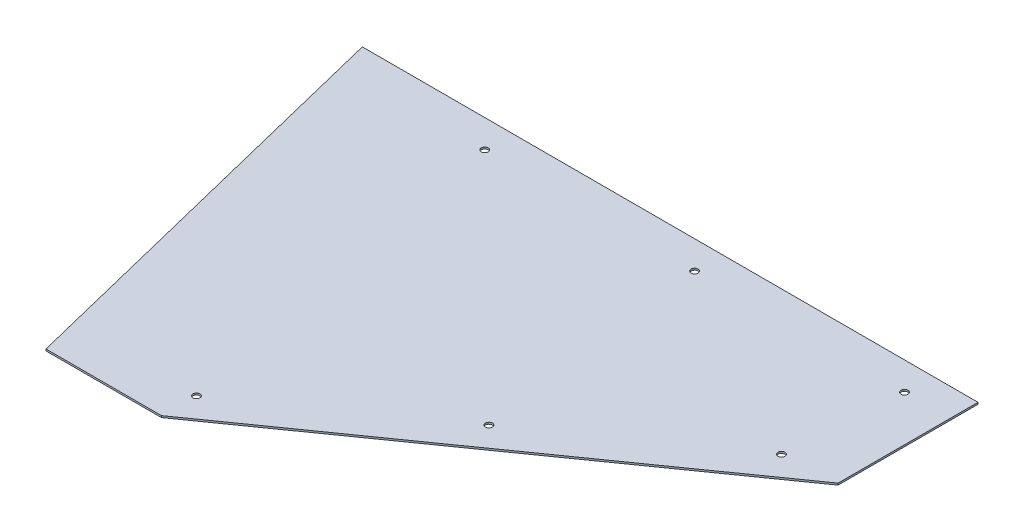
from build123d import *

# Parameters (mm, degrees)
BOSS_EXTRUDE1_DEPTH = 3.175
CUT_EXTRUDE1_REACH  = 1204.171
SKETCH2_R           = 6.35


with BuildPart() as part:
    # Sketch1 → Boss-Extrude1 (new body)
    with BuildSketch(Plane(origin=(0, 0, 0), x_dir=(1, 0, 0), z_dir=(0, 1, 0))):
        Polygon((0, 0), (209.454195023, 0), (929.817309408, 508), (929.817309408, 762), (-187.782690592, 762), align=None)
    extrude(amount=BOSS_EXTRUDE1_DEPTH)

    # Sketch2 → Cut-Extrude1 (cut, up to next)
    with BuildSketch(Plane(origin=(0, 3.175, 0), x_dir=(1, 0, 0), z_dir=(0, 1, 0)), mode=Mode.PRIVATE) as cut_extrude1_sk1:
        with Locations((847.267309408, 711.2)):
            Circle(SKETCH2_R)
    cut_extrude1_tool1 = extrude(cut_extrude1_sk1.sketch, amount=-CUT_EXTRUDE1_REACH, mode=Mode.PRIVATE) & part.part
    # Sketch2 → Cut-Extrude1 (cut, up to next)
    with BuildSketch(Plane(origin=(0, 3.175, 0), x_dir=(1, 0, 0), z_dir=(0, 1, 0)), mode=Mode.PRIVATE) as cut_extrude1_sk2:
        with Locations((466.267309408, 711.2)):
            Circle(SKETCH2_R)
    cut_extrude1_tool2 = extrude(cut_extrude1_sk2.sketch, amount=-CUT_EXTRUDE1_REACH, mode=Mode.PRIVATE) & part.part
    # Sketch2 → Cut-Extrude1 (cut, up to next)
    with BuildSketch(Plane(origin=(0, 3.175, 0), x_dir=(1, 0, 0), z_dir=(0, 1, 0)), mode=Mode.PRIVATE) as cut_extrude1_sk3:
        with Locations((85.267309408, 711.2)):
            Circle(SKETCH2_R)
    cut_extrude1_tool3 = extrude(cut_extrude1_sk3.sketch, amount=-CUT_EXTRUDE1_REACH, mode=Mode.PRIVATE) & part.part
    # Sketch2 → Cut-Extrude1 (cut, up to next)
    with BuildSketch(Plane(origin=(0, 3.175, 0), x_dir=(1, 0, 0), z_dir=(0, 1, 0)), mode=Mode.PRIVATE) as cut_extrude1_sk4:
        with Locations((833.078335041, 501.940846714)):
            Circle(SKETCH2_R)
    cut_extrude1_tool4 = extrude(cut_extrude1_sk4.sketch, amount=-CUT_EXTRUDE1_REACH, mode=Mode.PRIVATE) & part.part
    # Sketch2 → Cut-Extrude1 (cut, up to next)
    with BuildSketch(Plane(origin=(0, 3.175, 0), x_dir=(1, 0, 0), z_dir=(0, 1, 0)), mode=Mode.PRIVATE) as cut_extrude1_sk5:
        with Locations((521.713500583, 282.366394961)):
            Circle(SKETCH2_R)
    cut_extrude1_tool5 = extrude(cut_extrude1_sk5.sketch, amount=-CUT_EXTRUDE1_REACH, mode=Mode.PRIVATE) & part.part
    # Sketch2 → Cut-Extrude1 (cut, up to next)
    with BuildSketch(Plane(origin=(0, 3.175, 0), x_dir=(1, 0, 0), z_dir=(0, 1, 0)), mode=Mode.PRIVATE) as cut_extrude1_sk6:
        with Locations((210.348666125, 62.791943207)):
            Circle(SKETCH2_R)
    cut_extrude1_tool6 = extrude(cut_extrude1_sk6.sketch, amount=-CUT_EXTRUDE1_REACH, mode=Mode.PRIVATE) & part.part
    add(cut_extrude1_tool1.solids().sort_by_distance((847.267309, 3.175, -711.2))[0], mode=Mode.SUBTRACT)
    add(cut_extrude1_tool2.solids().sort_by_distance((466.267309, 3.175, -711.2))[0], mode=Mode.SUBTRACT)
    add(cut_extrude1_tool3.solids().sort_by_distance((85.267309, 3.175, -711.2))[0], mode=Mode.SUBTRACT)
    add(cut_extrude1_tool4.solids().sort_by_distance((833.078335, 3.175, -501.940847))[0], mode=Mode.SUBTRACT)
    add(cut_extrude1_tool5.solids().sort_by_distance((521.713501, 3.175, -282.366395))[0], mode=Mode.SUBTRACT)
    add(cut_extrude1_tool6.solids().sort_by_distance((210.348666, 3.175, -62.791943))[0], mode=Mode.SUBTRACT)


solid = part.part
